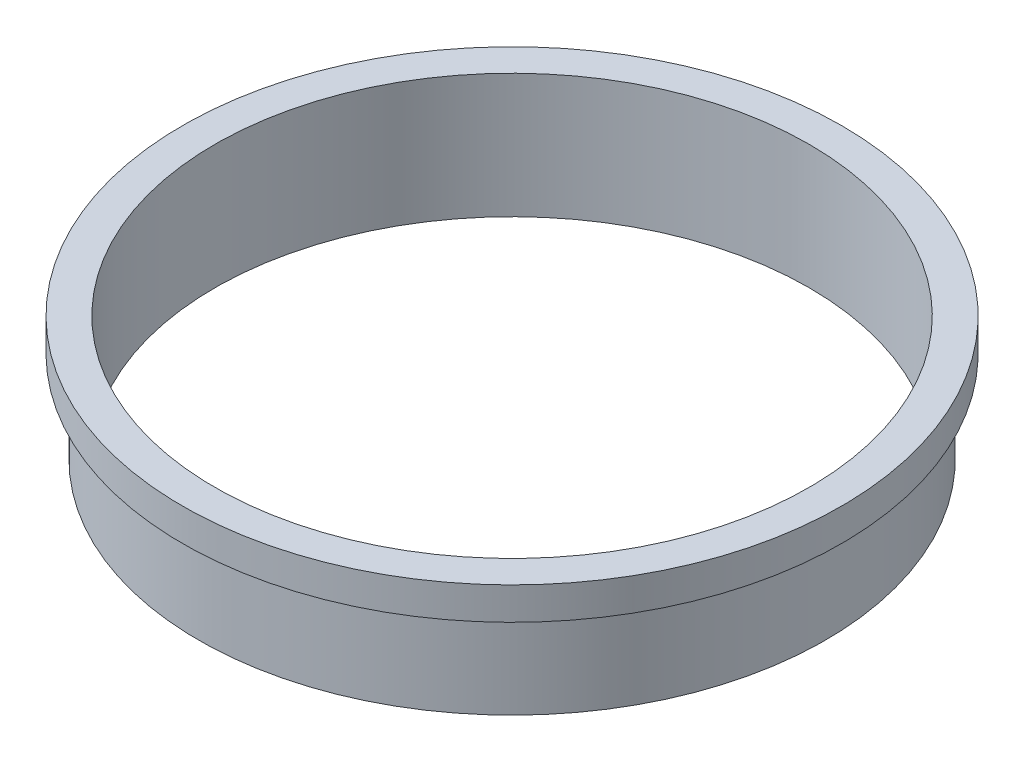
from build123d import *


with BuildPart() as part:
    # Sketch1 → Revolve1 (revolve)
    with BuildSketch(Plane.XY):
        Polygon((27.5, 11.5), (27.5, 0), (29, 0), (29, 8.5), (30.5, 8.5), (30.5, 11.5), align=None)
    revolve(axis=Axis((0, 0, 0), (0, 1, 0)))


solid = part.part
